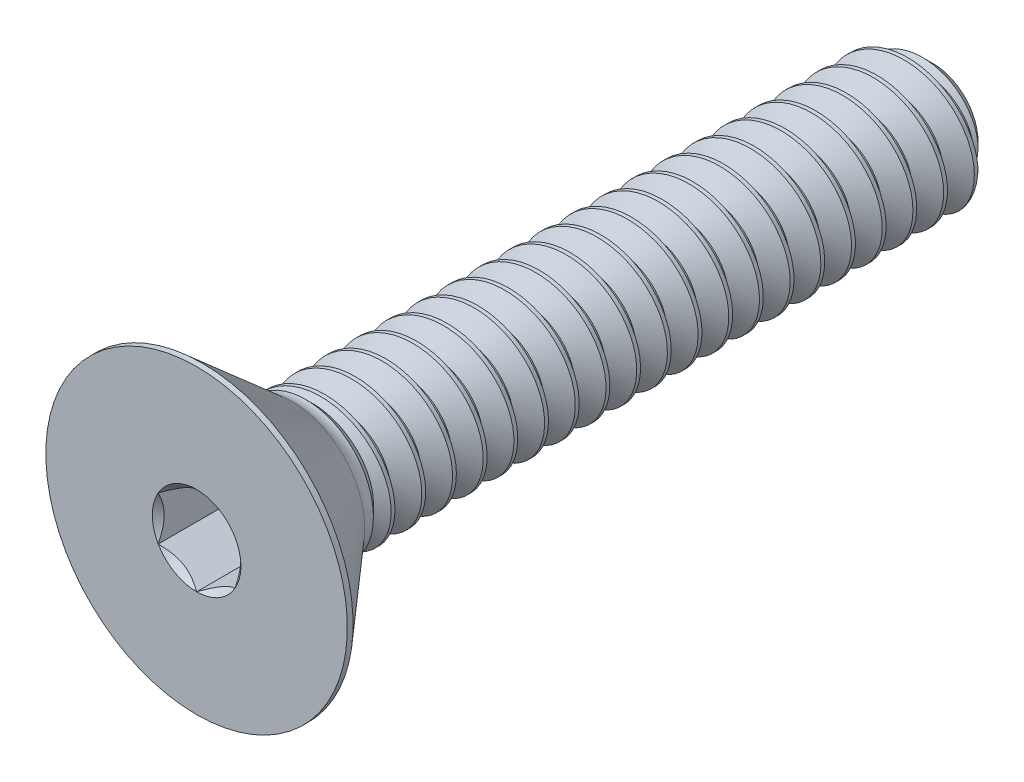
from build123d import *

# Parameters (mm, degrees)
SKETCH12_W         = 19.05
SKETCH12_H         = 1.7526
CHAMFER1_SIZE      = 0.5953125
CUT_EXTRUDE2_DEPTH = 1.72466
CUT_SWEEP1_PITCH   = 0.79375
CUT_SWEEP1_TO      = 16.230325


with BuildPart() as part:
    # Sketch12 → Revolve3 (revolve)
    with BuildSketch(Plane(origin=(0, 0, 0), x_dir=(0, 0, -1), z_dir=(1, 0, 0))):
        with Locations((0, 0.8763)):
            Rectangle(SKETCH12_W, SKETCH12_H)
    revolve(axis=Axis((0, 0, -9.525), (0, 0, 1)))

    # Sketch7 → Revolve2 (revolve)
    with BuildSketch(Plane(origin=(0, 0, 0), x_dir=(0, 0, -1), z_dir=(1, 0, 0)), mode=Mode.PRIVATE) as revolve2_sk:
        with BuildLine():
            Line((-9.525, 3.8989), (-9.377172, 3.8989))
            Line((-9.377172, 3.8989), (-7.0612, 1.885656255))
            ThreePointArc((-7.0612, 1.885656255), (-6.895292685, 1.786951775), (-6.70532488, 1.7526))
            Line((-6.70532488, 1.7526), (-6.70532488, 0))
            Line((-6.70532488, 0), (-9.525, 0))
            Line((-9.525, 0), (-9.525, 3.8989))
        make_face()
    revolve(revolve2_sk.sketch.rotate(Axis((0, 0, 9.525), (0, 0, -1)), 180), axis=Axis((0, 0, 9.525), (0, 0, -1)))

    # Boss-Extrude1 cone 1 section (through the dimple's axis) → Boss-Extrude1 (revolve)
    with BuildSketch(Plane(origin=(0, 0, 6.70532488), x_dir=(0, -1, 0), z_dir=(1, 0, 0))):
        Polygon((0, 0), (1.7526, 0), (0, 1.692466147), align=None)
    revolve(axis=Axis((0, 0, 6.70532488), (0, 0, -1)))

    # Chamfer1
    chamfer1_edges = [part.edges().sort_by_distance(p)[0] for p in [
        (0, -1.7526, -9.525),
    ]]
    chamfer(chamfer1_edges, length=CHAMFER1_SIZE)

    # Sketch5 → Cut-Extrude2 (cut)
    with BuildSketch(Plane.XY.offset(9.525)):
        Polygon((0, 1.14567944), (-0.9921875, 0.57283972), (-0.9921875, -0.57283972), (0, -1.14567944), (0.9921875, -0.57283972), (0.9921875, 0.57283972), align=None)
    extrude(amount=-CUT_EXTRUDE2_DEPTH, mode=Mode.SUBTRACT)

    # Cut-Extrude3 cone 1 section (through the dimple's axis) → Cut-Extrude3 (revolve, cut)
    with BuildSketch(Plane(origin=(0, 0, 9.525), x_dir=(0, -1, 0), z_dir=(1, 0, 0))):
        Polygon((0, 0), (1.14567944, 0), (0, 1.14567944), align=None)
    revolve(axis=Axis((0, 0, 9.525), (0, 0, -1)), mode=Mode.SUBTRACT)


with BuildPart() as body_2:
    # Split1: the piece on the far side of the plane
    add(part.part)
    split(bisect_by=Plane.XY.offset(6.70532488), keep=Keep.BOTTOM)

    # Cut-Sweep1: arcs per turn and ends read off the stored shape
    # Cut-Sweep1: the profile of Sketch2 profile screwed along a right-hand helix through 24 turns, 8 arcs to a turn; built about Z, then put on its axis
    cut_sweep1_z = Axis((0, 0, 0), (0, 0, 1))
    cut_sweep1_corners = [(1.7529, 0, 0.000173205), (1.7529, 0, -0.694704455), (1.237044252, 0, -0.396875), (1.237044252, 0, -0.29765625)]
    with BuildLine(mode=Mode.PRIVATE) as cut_sweep1_profile:
        Line(cut_sweep1_corners[0], cut_sweep1_corners[1])
        Line(cut_sweep1_corners[1], cut_sweep1_corners[2])
        Line(cut_sweep1_corners[2], cut_sweep1_corners[3])
        Line(cut_sweep1_corners[3], cut_sweep1_corners[0])
    cut_sweep1_cap = Face(cut_sweep1_profile.wire())
    cut_sweep1_turn_angles = [0, 22.5, 45, 67.5, 90, 112.5, 135, 157.5, 180, 202.5, 225, 247.5, 270, 292.5, 315, 337.5, 360]
    cut_sweep1_turn_weights = [1, 0.9238795325112867, 1, 0.9238795325112867, 1, 0.9238795325112867, 1, 0.9238795325112867, 1, 0.9238795325112867, 1, 0.9238795325112867, 1, 0.9238795325112867, 1, 0.9238795325112867, 1]
    cut_sweep1_turn_rails = [Edge.make_bspline([Vector(p[0], p[1], 0).rotate(cut_sweep1_z, cut_sweep1_turn_angles[k]) / cut_sweep1_turn_weights[k] + Vector(0, 0, p[2] + CUT_SWEEP1_PITCH * cut_sweep1_turn_angles[k] / 360) for k in range(17)], [0, 0, 0, 1, 1, 2, 2, 3, 3, 4, 4, 5, 5, 6, 6, 7, 7, 8, 8, 8], 2, cut_sweep1_turn_weights) for p in cut_sweep1_corners]
    cut_sweep1_turn_sides = [Face.make_surface_from_curves(cut_sweep1_turn_rails[p[0]], cut_sweep1_turn_rails[p[1]]) for p in [(0, 1), (1, 2), (2, 3), (3, 0)]]
    cut_sweep1 = Plane(origin=(0, 0, -9.525), x_dir=(0, 1, 0), z_dir=(0, 0, 1)) * split(Solid(Shell([*[p.moved(Location((0, 0, CUT_SWEEP1_PITCH * i))) for i in range(24) for p in cut_sweep1_turn_sides], cut_sweep1_cap, cut_sweep1_cap.rotate(cut_sweep1_z, 8640).moved(Location((0, 0, CUT_SWEEP1_PITCH * 8640 / 360)))])), bisect_by=Plane.XY.offset(CUT_SWEEP1_TO), keep=Keep.BOTTOM, mode=Mode.PRIVATE)
    add(cut_sweep1, mode=Mode.SUBTRACT)


with BuildPart() as part_1:
    add(part.part)

    # Split1
    split(bisect_by=Plane.XY.offset(6.70532488), keep=Keep.TOP)

    add(body_2.part)  # Boss-Extrude3 merges body 2
    # Boss-Extrude3 cone 1 section (through the dimple's axis) → Boss-Extrude3 (revolve)
    with BuildSketch(Plane(origin=(0, 0, 6.70532488), x_dir=(0, -1, 0), z_dir=(1, 0, 0))):
        Polygon((0, 0), (1.7526, 0), (0, 1.7526), align=None)
    revolve(axis=Axis((0, 0, 6.70532488), (0, 0, -1)))


solid = part_1.part
